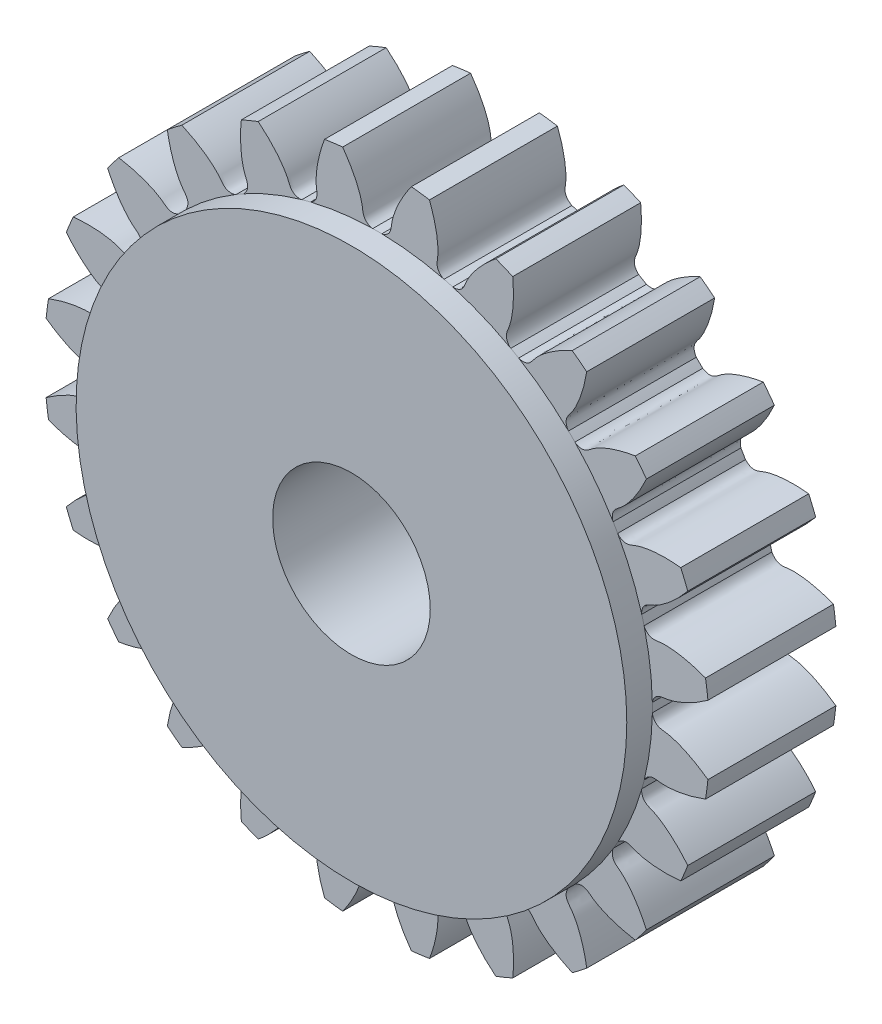
from build123d import *

# Parameters (mm, degrees)
SKETCH_1_R               = 6.5
EXTRUDE_1_DEPTH          = 2.5
CUT_EXTRUDE_1_DEPTH      = 10.526279442
PATTERN_CIRCULAR_1_COUNT = 24
SKETCH_6_R               = 5.38
EXTRUDE_2_DEPTH          = 0.5
SKETCH_4_R               = 1.54
CUT_EXTRUDE_2_DEPTH      = 5


with BuildPart() as part:
    # 草图1 → 凸台-拉伸1 (new body)
    with BuildSketch(Plane.XY):
        Circle(SKETCH_1_R)
    extrude(amount=EXTRUDE_1_DEPTH)

    # 草图2 → 切除-拉伸1 (cut, through all)
    with BuildSketch(Plane.XY):
        with BuildLine():
            ThreePointArc((0.088415956, 5.374272753), (0, 5.375), (-0.088415956, 5.374272753))
            add(Edge.make_bspline(
                [(-0.088415956, 5.374272753), (-0.283956108, 5.428430036), (-0.269523883, 5.557861799), (-0.293138588, 5.686342226), (-0.296517959, 5.702916521), (-0.300724242, 5.721620073), (-0.305840304, 5.742426358), (-0.311952817, 5.765305336), (-0.319146149, 5.790224685), (-0.327504211, 5.817149434), (-0.337109789, 5.846042111), (-0.348044663, 5.876862729), (-0.360389484, 5.909568827), (-0.374223721, 5.944115495), (-0.389625595, 5.980455405), (-0.406672011, 6.018538843), (-0.425438499, 6.058313744), (-0.445999145, 6.099725726), (-0.468426535, 6.142718129), (-0.492791687, 6.187232054), (-0.519163995, 6.233206399), (-0.547611171, 6.280577906), (-0.57819918, 6.329281201), (-0.610992189, 6.379248841), (-0.64605251, 6.430411359), (-0.68344054, 6.482697309), (-0.723214712, 6.53603332), (-0.765431443, 6.590344144), (-0.810145078, 6.645552705), (-0.857407842, 6.701580158), (-0.907269792, 6.758345935), (-0.959778768, 6.81576781), (-1.014980347, 6.873761948), (-1.0729178, 6.932242967), (-1.133632047, 6.991123994), (-1.197161611, 7.05031673), (-1.263542589, 7.109731505), (-1.332808587, 7.169277345), (-1.430211047, 7.249680778), (-1.505961903, 7.308439159), (-1.55780976, 7.347058965)],
                knots=[0, 0, 0, 0, 0.143961355, 0.149818462, 0.156576662, 0.164235955, 0.172796342, 0.182257821, 0.192620395, 0.203884061, 0.216048821, 0.229114674, 0.24308162, 0.25794966, 0.273718793, 0.290389019, 0.307960339, 0.326432751, 0.345806258, 0.366080857, 0.38725655, 0.409333336, 0.432311215, 0.456190188, 0.480970254, 0.506651413, 0.533233666, 0.560717012, 0.589101451, 0.618386984, 0.64857361, 0.679661329, 0.711650141, 0.744540047, 0.778331046, 0.813023138, 0.848616324, 0.885110603, 0.922505975, 1, 1, 1, 1], degree=3))
            ThreePointArc((-1.55780976, 7.347058965), (0, 7.510395907), (1.55780976, 7.347058965))
            add(Edge.make_bspline(
                [(0.088415956, 5.374272753), (0.283956108, 5.428430036), (0.269523883, 5.557861799), (0.293138588, 5.686342226), (0.296517959, 5.702916521), (0.300724242, 5.721620073), (0.305840304, 5.742426358), (0.311952817, 5.765305336), (0.319146149, 5.790224685), (0.327504211, 5.817149434), (0.337109789, 5.846042111), (0.348044663, 5.876862729), (0.360389484, 5.909568827), (0.374223721, 5.944115495), (0.389625595, 5.980455405), (0.406672011, 6.018538843), (0.425438499, 6.058313744), (0.445999145, 6.099725726), (0.468426535, 6.142718129), (0.492791687, 6.187232054), (0.519163995, 6.233206399), (0.547611171, 6.280577906), (0.57819918, 6.329281201), (0.610992189, 6.379248841), (0.64605251, 6.430411359), (0.68344054, 6.482697309), (0.723214712, 6.53603332), (0.765431443, 6.590344144), (0.810145078, 6.645552705), (0.857407842, 6.701580158), (0.907269792, 6.758345935), (0.959778768, 6.81576781), (1.014980347, 6.873761948), (1.0729178, 6.932242967), (1.133632047, 6.991123994), (1.197161611, 7.05031673), (1.263542589, 7.109731505), (1.332808587, 7.169277345), (1.430211047, 7.249680778), (1.505961903, 7.308439159), (1.55780976, 7.347058965)],
                knots=[0, 0, 0, 0, 0.143961355, 0.149818462, 0.156576662, 0.164235955, 0.172796342, 0.182257821, 0.192620395, 0.203884061, 0.216048821, 0.229114674, 0.24308162, 0.25794966, 0.273718793, 0.290389019, 0.307960339, 0.326432751, 0.345806258, 0.366080857, 0.38725655, 0.409333336, 0.432311215, 0.456190188, 0.480970254, 0.506651413, 0.533233666, 0.560717012, 0.589101451, 0.618386984, 0.64857361, 0.679661329, 0.711650141, 0.744540047, 0.778331046, 0.813023138, 0.848616324, 0.885110603, 0.922505975, 1, 1, 1, 1], degree=3))
        make_face()
    cut_extrude_1 = extrude(amount=CUT_EXTRUDE_1_DEPTH, mode=Mode.SUBTRACT)

    # 阵列(圆周)1: 切除-拉伸1 ×24 about axis
    pattern_circular_1_axis = Axis((0, 0, 2.5), (0, 0, -1))
    for i in range(1, PATTERN_CIRCULAR_1_COUNT):
        add(cut_extrude_1.rotate(pattern_circular_1_axis, i * 360 / PATTERN_CIRCULAR_1_COUNT), mode=Mode.SUBTRACT)

    # 草图6 → 凸台-拉伸2 (add)
    with BuildSketch(Plane.XY.offset(2.5)):
        Circle(SKETCH_6_R)
    extrude(amount=EXTRUDE_2_DEPTH)

    # 草图4 → 切除-拉伸2 (cut, symmetric)
    with BuildSketch(Plane.XY.offset(2.5)):
        Circle(SKETCH_4_R)
    extrude(amount=CUT_EXTRUDE_2_DEPTH, both=True, mode=Mode.SUBTRACT)


solid = part.part
